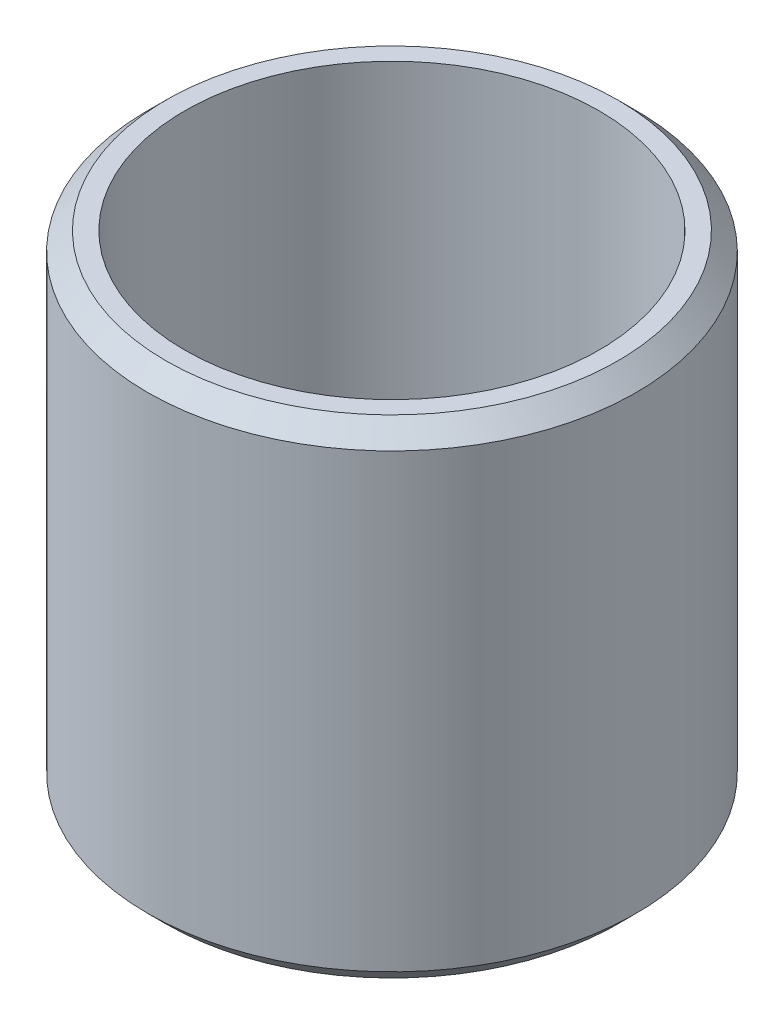
from build123d import *

# Parameters (mm, degrees)
SKETCH1_R            = 20.032
SKETCH1_R_2          = 17
EXTRUDE1_DEPTH       = 20
BUSHING_CHAMFER_SIZE = 1.5


with BuildPart() as part:
    # Sketch1 → Extrude1 (new, symmetric)
    with BuildSketch(Plane(origin=(0, 0, 0), x_dir=(1, 0, 0), z_dir=(0, 1, 0))):
        Circle(SKETCH1_R)
        Circle(SKETCH1_R_2, mode=Mode.SUBTRACT)
    extrude(amount=EXTRUDE1_DEPTH, both=True)

    # Bushing Chamfer
    bushing_chamfer_edges = [part.edges().sort_by_distance(p)[0] for p in [
        (-20.032, 20, 0),
        (-20.032, -20, 0),
    ]]
    chamfer(bushing_chamfer_edges, length=BUSHING_CHAMFER_SIZE)


solid = part.part
